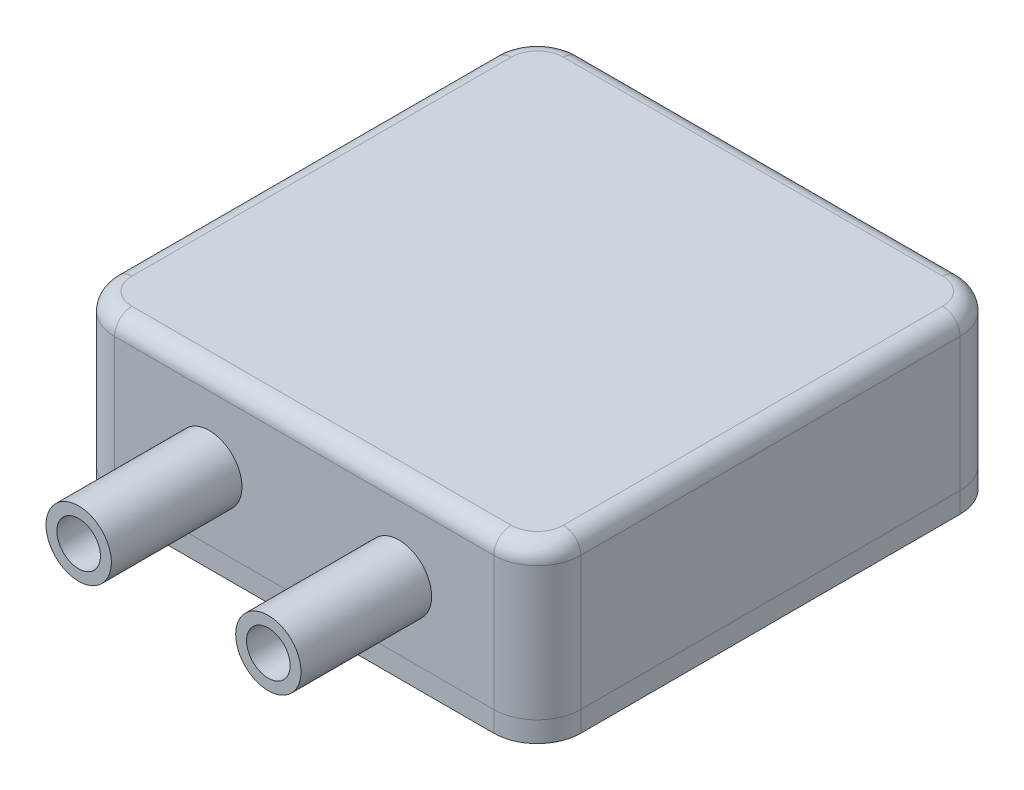
from build123d import *

# Parameters (mm, degrees)
SKETCH1_W           = 68
SKETCH1_H           = 68
BOSS_EXTRUDE1_DEPTH = 22
FILLET1_R           = 2.54
FILLET2_R           = 6.35
SKETCH2_R           = 4.7625
SKETCH2_R_2         = 3.175
BOSS_EXTRUDE2_DEPTH = 19.05
SKETCH3_W           = 68
SKETCH3_H           = 68
BOSS_EXTRUDE3_DEPTH = 3
FILLET3_R           = 6.35


with BuildPart() as part:
    # Sketch1 → Boss-Extrude1 (new body)
    with BuildSketch(Plane(origin=(0, 0, 0), x_dir=(1, 0, 0), z_dir=(0, 1, 0))):
        Rectangle(SKETCH1_W, SKETCH1_H)
    extrude(amount=BOSS_EXTRUDE1_DEPTH)

    # Fillet1
    fillet1_edges = [part.edges().sort_by_distance(p)[0] for p in [
        (-34, 22, 0),
        (0, 22, 34),
        (34, 22, 0),
        (0, 22, -34),
    ]]
    fillet(fillet1_edges, radius=FILLET1_R)

    # Fillet2
    # the kernel refuses this fillet: 6.35 mm, written as the material it takes off along each edge
    with BuildSketch(Plane(origin=(27.65, 22, -27.65), x_dir=(1, 0, 0), z_dir=(0, 0, 1))) as fillet2_piece_1:
        with BuildLine():
            CenterArc((3.81, -2.54), 2.54, 0, 90)
            Line((6.35, -2.54), (6.35, 0))
            Line((6.35, 0), (3.81, 0))
        make_face()
    revolve(axis=Axis((27.65, 22, -27.65), (0, 1, 0)), revolution_arc=90, mode=Mode.SUBTRACT)
    with BuildSketch(Plane(origin=(27.65, 22, 27.65), x_dir=(0, 0, 1), z_dir=(-1, 0, 0))) as fillet2_piece_2:
        with BuildLine():
            CenterArc((3.81, -2.54), 2.54, 0, 90)
            Line((6.35, -2.54), (6.35, 0))
            Line((6.35, 0), (3.81, 0))
        make_face()
    revolve(axis=Axis((27.65, 22, 27.65), (0, 1, 0)), revolution_arc=90, mode=Mode.SUBTRACT)
    with BuildSketch(Plane(origin=(-27.65, 22, -27.65), x_dir=(0, 0, -1), z_dir=(1, 0, 0))) as fillet2_piece_3:
        with BuildLine():
            CenterArc((3.81, -2.54), 2.54, 0, 90)
            Line((6.35, -2.54), (6.35, 0))
            Line((6.35, 0), (3.81, 0))
        make_face()
    revolve(axis=Axis((-27.65, 22, -27.65), (0, 1, 0)), revolution_arc=90, mode=Mode.SUBTRACT)
    with BuildSketch(Plane(origin=(-27.65, 22, 27.65), x_dir=(-1, 0, 0), z_dir=(0, 0, -1))) as fillet2_piece_4:
        with BuildLine():
            CenterArc((3.81, -2.54), 2.54, 0, 90)
            Line((6.35, -2.54), (6.35, 0))
            Line((6.35, 0), (3.81, 0))
        make_face()
    revolve(axis=Axis((-27.65, 22, 27.65), (0, 1, 0)), revolution_arc=90, mode=Mode.SUBTRACT)
    with BuildSketch(Plane(origin=(-34, -15.875, 34), x_dir=(0, 0, -1), z_dir=(0, 1, 0)), Plane(origin=(-34, -15.875, -34), x_dir=(1, 0, 0), z_dir=(0, 1, 0))) as fillet2_piece_5:
        with BuildLine():
            CenterArc((FILLET2_R, -FILLET2_R), FILLET2_R, 90, 90)
            Line((0, -FILLET2_R), (0, 0))
            Line((0, 0), (FILLET2_R, 0))
        make_face()
    extrude(amount=37.875, mode=Mode.SUBTRACT)
    with BuildSketch(Plane(origin=(34, -15.875, -34), x_dir=(-1, 0, 0), z_dir=(0, 1, 0)), Plane(origin=(34, -15.875, 34), x_dir=(0, 0, -1), z_dir=(0, 1, 0))) as fillet2_piece_6:
        with BuildLine():
            CenterArc((FILLET2_R, FILLET2_R), FILLET2_R, 180, 90)
            Line((0, FILLET2_R), (0, 0))
            Line((0, 0), (FILLET2_R, 0))
        make_face()
    extrude(amount=37.875, mode=Mode.SUBTRACT)

    # Sketch2 → Boss-Extrude2 (add)
    # profile 1 of 2: a face of its own
    with BuildSketch(Plane.XY.offset(34)):
        with Locations(Location((-13.8303, 9.73, 0), (0, 0, 180))):
            Circle(SKETCH2_R)
        with Locations(Location((-13.8303, 9.73, 0), (0, 0, 180))):
            Circle(SKETCH2_R_2, mode=Mode.SUBTRACT)
    # profile 2 of 2: a face of its own
    with BuildSketch(Plane.XY.offset(34)):
        with Locations(Location((13.8303, 9.73, 0), (0, 0, 180))):
            Circle(SKETCH2_R)
        with Locations(Location((13.8303, 9.73, 0), (0, 0, 180))):
            Circle(SKETCH2_R_2, mode=Mode.SUBTRACT)
    extrude(amount=BOSS_EXTRUDE2_DEPTH)


with BuildPart() as body_2:
    # Sketch3 → Boss-Extrude3 (new body)
    with BuildSketch(Plane.XZ):
        Rectangle(SKETCH3_W, SKETCH3_H)
    extrude(amount=BOSS_EXTRUDE3_DEPTH)

    # Fillet3
    fillet3_edges = [body_2.edges().sort_by_distance(p)[0] for p in [
        (34, -1.5, -34),
        (-34, -1.5, -34),
        (-34, -1.5, 34),
        (34, -1.5, 34),
    ]]
    fillet(fillet3_edges, radius=FILLET3_R)


solid = Compound([part.part, body_2.part])
